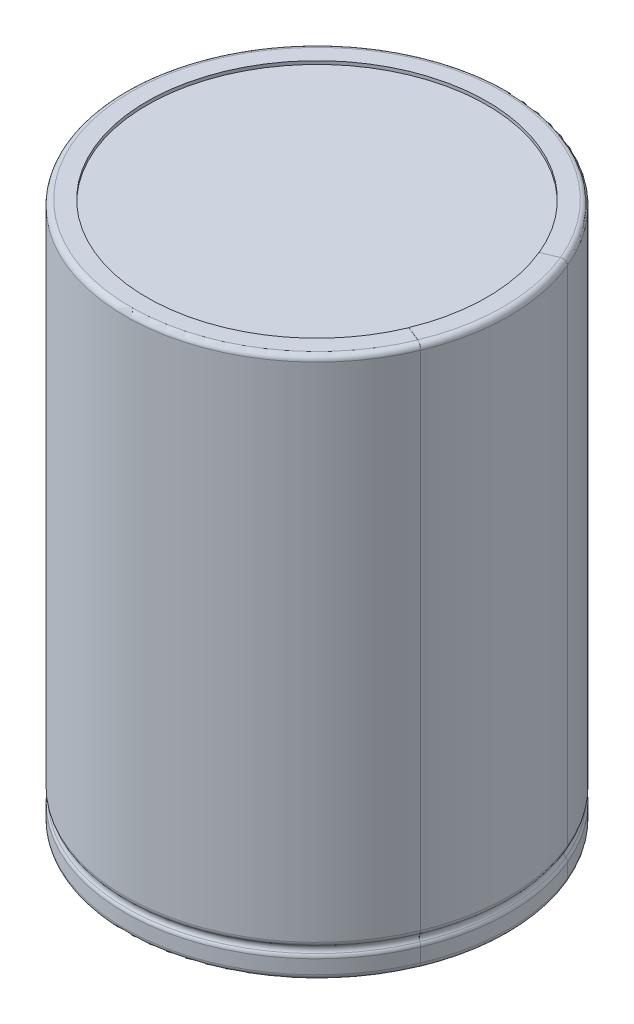
from build123d import *

# Parameters (mm, degrees)
SKETCH2_R      = 0.5
EXTRUDE1_DEPTH = 3
REVOLVE2_ANGLE = 45


with BuildPart() as part:
    # Sketch1 → Revolve1 (revolve)
    with BuildSketch(Plane.XY):
        with BuildLine():
            Line((0, 0.3), (0, 49.7))
            Line((0, 49.7), (15.7, 49.7))
            Line((15.7, 49.7), (15.7, 50))
            Line((15.7, 50), (17.2, 50))
            ThreePointArc((17.2, 50), (17.553553391, 49.853553391), (17.7, 49.5))
            Line((17.7, 49.5), (17.7, 3.09445053))
            ThreePointArc((17.7, 3.09445053), (17.667707173, 2.917673834), (17.575, 2.763731616))
            ThreePointArc((17.575, 2.763731616), (17.45, 2.433012702), (17.575, 2.102293788))
            ThreePointArc((17.575, 2.102293788), (17.667707173, 1.948351569), (17.7, 1.771574874))
            Line((17.7, 1.771574874), (17.7, 0.5))
            ThreePointArc((17.7, 0.5), (17.553553391, 0.146446609), (17.2, 0))
            Line((17.2, 0), (15.7, 0))
            Line((15.7, 0), (15.7, 0.3))
            Line((15.7, 0.3), (0, 0.3))
        make_face()
    revolve(axis=Axis((0, 0, 0), (0, -1, 0)))

    # Sketch2 → Extrude1 (add)
    with BuildSketch(Plane.XZ.offset(-0.3)):
        with Locations((-5, 0)):
            Circle(SKETCH2_R)
        with Locations((5, 0)):
            Circle(SKETCH2_R)
    extrude(amount=EXTRUDE1_DEPTH)

    # Sketch3 → Revolve2 (revolve, symmetric)
    with BuildSketch(Plane.XY) as revolve2_sk:
        with BuildLine():
            Line((15.69, 50.01), (15.69, -0.01))
            Line((15.69, -0.01), (17.2, -0.01))
            ThreePointArc((17.2, -0.01), (17.560624458, 0.139375542), (17.71, 0.5))
            Line((17.71, 0.5), (17.71, 1.771574874))
            ThreePointArc((17.71, 1.771574874), (17.677061317, 1.951887103), (17.5825, 2.108908166))
            ThreePointArc((17.5825, 2.108908166), (17.46, 2.433012702), (17.5825, 2.757117237))
            ThreePointArc((17.5825, 2.757117237), (17.677061317, 2.9141383), (17.71, 3.09445053))
            Line((17.71, 3.09445053), (17.71, 49.5))
            ThreePointArc((17.71, 49.5), (17.560624458, 49.860624458), (17.2, 50.01))
            Line((17.2, 50.01), (15.69, 50.01))
        make_face()
    revolve(axis=Axis((-0.01, 49.71, 0), (0, -1, 0)), revolution_arc=REVOLVE2_ANGLE / 2)
    revolve(revolve2_sk.sketch, axis=Axis((-0.01, 49.71, 0), (0, 1, 0)), revolution_arc=REVOLVE2_ANGLE / 2)


solid = part.part
